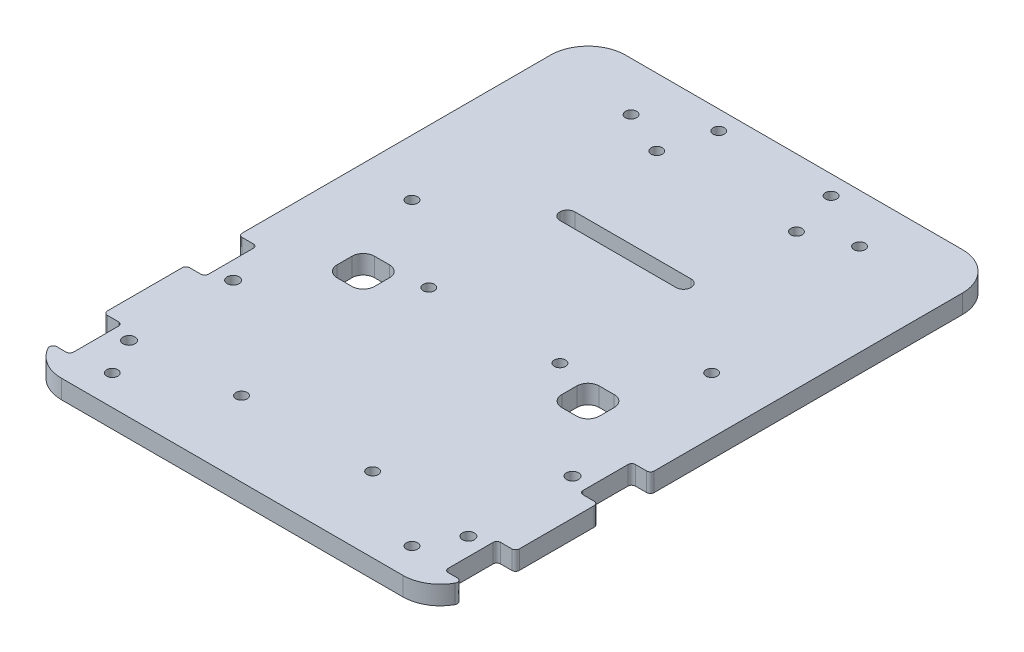
from build123d import *

# Parameters (mm, degrees)
SKETCH1_R           = 1.6
SKETCH1_W           = 10
SKETCH1_H           = 10
SKETCH1_R_2         = 1.5
SKETCH1_W_2         = 35
SKETCH1_H_2         = 4
BOSS_EXTRUDE1_DEPTH = 5
FILLET1_R           = 10
FILLET2_R           = 2
FILLET3_R           = 3
FILLET4_R           = 1
FILLET5_R           = 1


# Some blends are built 0.0001 mm under size
with BuildPart() as part:
    # Sketch1 → Boss-Extrude1 (new body)
    with BuildSketch(Plane(origin=(0, 0, 0), x_dir=(1, 0, 0), z_dir=(0, 1, 0))):
        Polygon((55, 75), (-55, 75), (-55, -18.337824516), (-50, -18.337824516), (-50, -32.337824516), (-55, -32.337824516), (-55, -54.337824516), (-50, -54.337824516), (-50, -68.337824516), (-55, -68.337824516), (-55, -75), (55, -75), (55, -68.337824516), (50, -68.337824516), (50, -54.337824516), (55, -54.337824516), (55, -32.337824516), (50, -32.337824516), (50, -18.337824516), (55, -18.337824516), align=None)
        with Locations(Location((-45.3, -29.437824516, 0), (0, 0, 270))):
            Circle(SKETCH1_R, mode=Mode.SUBTRACT)
        with Locations((-30, -10)):
            Rectangle(SKETCH1_W, SKETCH1_H, mode=Mode.SUBTRACT)
        with Locations(Location((-17.5, -5, 0), (0, 0, 270))):
            Circle(SKETCH1_R_2, mode=Mode.SUBTRACT)
        with Locations(Location((17.5, -5, 0), (0, 0, 270))):
            Circle(SKETCH1_R_2, mode=Mode.SUBTRACT)
        with Locations(Location((45.3, -29.437824516, 0), (0, 0, 270))):
            Circle(SKETCH1_R, mode=Mode.SUBTRACT)
        with Locations((30, -10)):
            Rectangle(SKETCH1_W, SKETCH1_H, mode=Mode.SUBTRACT)
        with Locations(Location((-40, 13, 0), (0, 0, 270))):
            Circle(SKETCH1_R_2, mode=Mode.SUBTRACT)
        with Locations((0, 30)):
            Rectangle(SKETCH1_W_2, SKETCH1_H_2, mode=Mode.SUBTRACT)
        with Locations(Location((-30.5, 62, 0), (0, 0, 270))):
            Circle(SKETCH1_R_2, mode=Mode.SUBTRACT)
        with Locations(Location((-18.65, 57, 0), (0, 0, 270))):
            Circle(SKETCH1_R_2, mode=Mode.SUBTRACT)
        with Locations(Location((-15, 69.897229132, 0), (0, 0, 270))):
            Circle(SKETCH1_R_2, mode=Mode.SUBTRACT)
        with Locations(Location((40, 13, 0), (0, 0, 270))):
            Circle(SKETCH1_R_2, mode=Mode.SUBTRACT)
        with Locations(Location((18.65, 57, 0), (0, 0, 270))):
            Circle(SKETCH1_R_2, mode=Mode.SUBTRACT)
        with Locations(Location((15, 69.897229132, 0), (0, 0, 270))):
            Circle(SKETCH1_R_2, mode=Mode.SUBTRACT)
        with Locations(Location((30.5, 62, 0), (0, 0, 270))):
            Circle(SKETCH1_R_2, mode=Mode.SUBTRACT)
        with Locations(Location((-45.3, -57.237824516, 0), (0, 0, 270))):
            Circle(SKETCH1_R, mode=Mode.SUBTRACT)
        with Locations(Location((-40, -67, 0), (0, 0, 270))):
            Circle(SKETCH1_R_2, mode=Mode.SUBTRACT)
        with Locations(Location((-17.5, -55, 0), (0, 0, 270))):
            Circle(SKETCH1_R_2, mode=Mode.SUBTRACT)
        with Locations(Location((17.5, -55, 0), (0, 0, 270))):
            Circle(SKETCH1_R_2, mode=Mode.SUBTRACT)
        with Locations(Location((40, -67, 0), (0, 0, 270))):
            Circle(SKETCH1_R_2, mode=Mode.SUBTRACT)
        with Locations(Location((45.3, -57.237824516, 0), (0, 0, 270))):
            Circle(SKETCH1_R, mode=Mode.SUBTRACT)
    extrude(amount=BOSS_EXTRUDE1_DEPTH)

    # Fillet1
    # the kernel refuses this fillet: 10 mm, written as the material it takes off along each edge
    with BuildSketch(Plane(origin=(55, -23.566253348, 75), x_dir=(-1, 0, 0), z_dir=(0, 1, 0))) as fillet1_piece_1:
        with BuildLine():
            CenterArc((9.426501339, -10), FILLET1_R, 90, 70.501483543)
            Line((0, -6.662175484), (-0.188530027, -6.595418994))
            ThreePointArc((-0.188530027, -6.595418994), (-0.2, -3.331087742), (-0.2, 0))
            Line((-0.2, 0), (0, 0.2))
            Line((0, 0.2), (9.426501339, 0.2))
            Line((9.426501339, 0.2), (9.426501339, 0))
        make_face()
    extrude(amount=52.132506697, mode=Mode.SUBTRACT)
    with BuildSketch(Plane(origin=(-55, -23.566253348, 75), x_dir=(0, 0, -1), z_dir=(0, 1, 0))) as fillet1_piece_2:
        with BuildLine():
            CenterArc((10, -9.426501339), FILLET1_R, 109.498516457, 70.501483543)
            Line((0, -9.426501339), (-0.2, -9.426501339))
            Line((-0.2, -9.426501339), (-0.2, 0))
            Line((-0.2, 0), (0, 0.2))
            ThreePointArc((0, 0.2), (3.331087742, 0.2), (6.595418994, 0.188530027))
            Line((6.595418994, 0.188530027), (6.662175484, 0))
        make_face()
    extrude(amount=52.132506697, mode=Mode.SUBTRACT)
    with BuildSketch(Plane(origin=(-55, -25, -75), x_dir=(1, 0, 0), z_dir=(0, 1, 0)), Plane(origin=(55, -25, -75), x_dir=(0, 0, 1), z_dir=(0, 1, 0))) as fillet1_piece_3:
        with BuildLine():
            CenterArc((FILLET1_R, -FILLET1_R), FILLET1_R, 90, 90)
            Line((0, -FILLET1_R), (-FILLET1_R * 0.02, -FILLET1_R))
            Line((-FILLET1_R * 0.02, -FILLET1_R), (-FILLET1_R * 0.02, FILLET1_R * 0.02))
            Line((-FILLET1_R * 0.02, FILLET1_R * 0.02), (FILLET1_R, FILLET1_R * 0.02))
            Line((FILLET1_R, FILLET1_R * 0.02), (FILLET1_R, 0))
        make_face()
    extrude(amount=55, mode=Mode.SUBTRACT)

    # Fillet2
    fillet2_edges = [part.edges().sort_by_distance(p)[0] for p in [
        (-17.5, 2.5, -28),
        (-17.5, 2.5, -32),
        (17.5, 2.5, -28),
        (17.5, 2.5, -32),
    ]]
    fillet(fillet2_edges, radius=FILLET2_R - 0.0001)  # a hair under: the kernel refuses the full size

    # Fillet3
    fillet3_edges = [part.edges().sort_by_distance(p)[0] for p in [
        (25, 2.5, 5),
        (25, 2.5, 15),
        (35, 2.5, 15),
        (35, 2.5, 5),
        (-35, 2.5, 5),
        (-35, 2.5, 15),
        (-25, 2.5, 15),
        (-25, 2.5, 5),
    ]]
    fillet(fillet3_edges, radius=FILLET3_R)

    # Fillet4
    fillet4_edges = [part.edges().sort_by_distance(p)[0] for p in [
        (-55, 2.5, 68.337824516),
        (-50, 2.5, 68.337824516),
        (-50, 2.5, 54.337824516),
        (-55, 2.5, 54.337824516),
        (-55, 2.5, 32.337824516),
        (-50, 2.5, 32.337824516),
        (-50, 2.5, 18.337824516),
        (-55, 2.5, 18.337824516),
    ]]
    fillet(fillet4_edges, radius=FILLET4_R)

    # Fillet5
    fillet5_edges = [part.edges().sort_by_distance(p)[0] for p in [
        (55, 2.5, 54.337824516),
        (50, 2.5, 54.337824516),
        (50, 2.5, 68.337824516),
        (55, 2.5, 68.337824516),
        (55, 2.5, 18.337824516),
        (50, 2.5, 18.337824516),
        (50, 2.5, 32.337824516),
        (55, 2.5, 32.337824516),
    ]]
    fillet(fillet5_edges, radius=FILLET5_R)


solid = part.part
